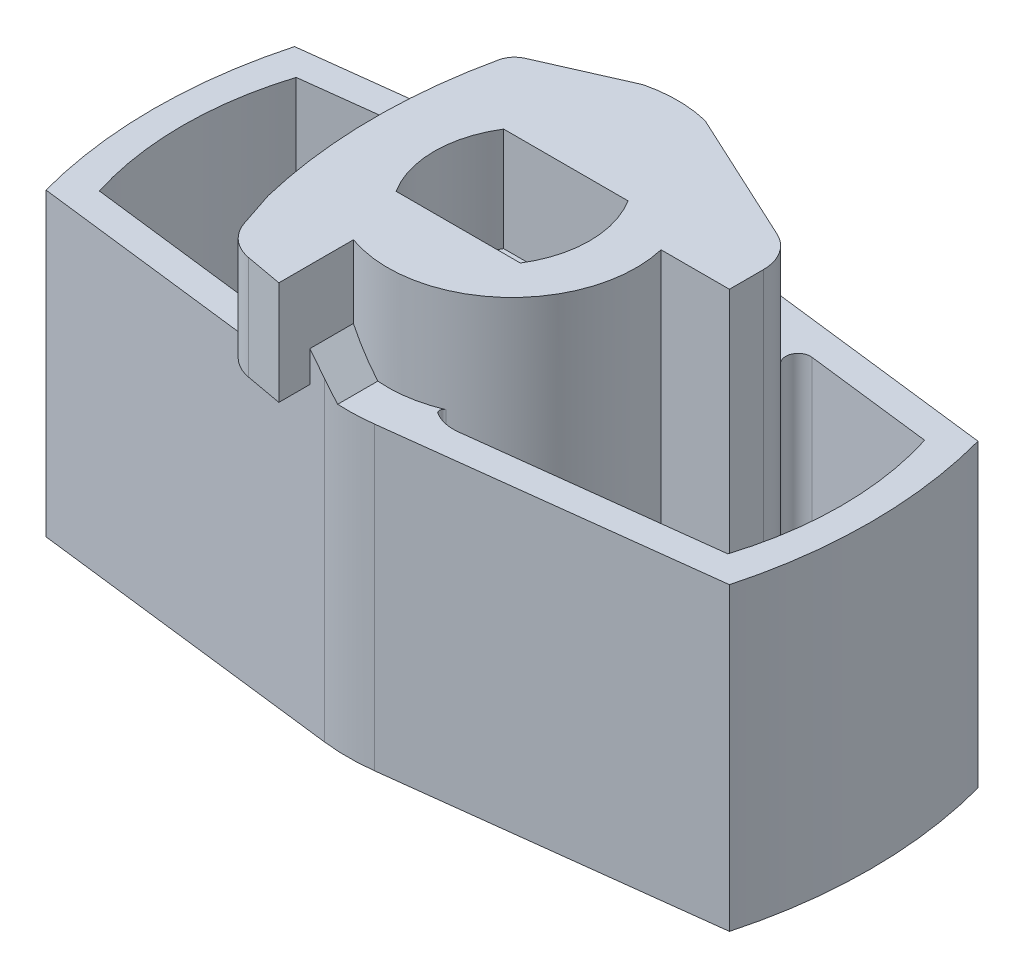
from build123d import *

# Parameters (mm, degrees)
BOSS_EXTRUDE1_DEPTH = 14.5
SKETCH1_3_R         = 1.9999999999999996
BOSS_EXTRUDE2_DEPTH = 2
SKETCH2_R           = 1.9999999999999996
BOSS_EXTRUDE3_DEPTH = 12.5
BOSS_EXTRUDE4_START = -2
SKETCH2_2_R         = 1.9999999999999996
BOSS_EXTRUDE4_DEPTH = 2
BOSS_EXTRUDE5_DEPTH = 5
CHAMFER1_SIZE       = 1.5
FILLET3_R           = 2
FILLET1_R           = 0.6
FILLET4_R           = 2
FILLET5_R           = 0.2
FILLET6_R           = 1
FILLET7_R           = 10


with BuildPart() as part:
    # Sketch1 → Boss-Extrude1 (new body)
    with BuildSketch(Plane(origin=(0, 0, 0), x_dir=(1, 0, 0), z_dir=(0, 1, 0))):
        with BuildLine():
            ThreePointArc((33, 12), (33.8, 6), (33, 0))
            Line((33, 0), (16.499999999999837, -2.00000000000002))
            Line((16.499999999999837, -2.00000000000002), (0, 0))
            ThreePointArc((0, 0), (-0.7999999999999936, 5.999999999999997), (0, 12))
            Line((0, 12), (16.499999999999837, 13.99999999999998))
            Line((16.499999999999837, 13.99999999999998), (33, 12))
        make_face()
        with BuildLine():
            Line((16.49999999999997, 12.589752836725182), (31.673748690170243, 10.750510571250008))
            ThreePointArc((31.673748690170243, 10.750510571250008), (32.39999999999999, 5.999999999999953), (31.673748690170243, 1.2494894287498812))
            Line((31.673748690170243, 1.2494894287498812), (16.49999999999984, -0.5897528367253209))
            Line((16.49999999999984, -0.5897528367253209), (1.3262513098297308, 1.2494894287498826))
            ThreePointArc((1.3262513098297308, 1.2494894287498826), (0.5999999999999286, 5.999999999999944), (1.3262513098297308, 10.750510571250004))
            Line((1.3262513098297308, 10.750510571250004), (16.49999999999997, 12.589752836725182))
        make_face(mode=Mode.SUBTRACT)
    extrude(amount=BOSS_EXTRUDE1_DEPTH)

    # Sketch1<3> → Boss-Extrude2 (add)
    with BuildSketch(Plane(origin=(0, 0, 0), x_dir=(1, 0, 0), z_dir=(0, 1, 0))):
        with BuildLine():
            ThreePointArc((31.673748690170243, 10.750510571250008), (32.39999999999999, 5.999999999999953), (31.673748690170243, 1.2494894287498812))
            Line((31.673748690170243, 1.2494894287498812), (16.49999999999984, -0.5897528367253209))
            Line((16.49999999999984, -0.5897528367253209), (1.3262513098297308, 1.2494894287498826))
            ThreePointArc((1.3262513098297308, 1.2494894287498826), (0.5999999999999286, 5.999999999999944), (1.3262513098297308, 10.750510571250004))
            Line((1.3262513098297308, 10.750510571250004), (16.49999999999997, 12.589752836725182))
            Line((16.49999999999997, 12.589752836725182), (31.673748690170243, 10.750510571250008))
        make_face()
        with Locations(Location((16.499999999999837, 5.999999999999998, 0), (0, 0, 270))):
            Circle(SKETCH1_3_R, mode=Mode.SUBTRACT)
    extrude(amount=BOSS_EXTRUDE2_DEPTH)

    # Sketch2 → Boss-Extrude3 (add)
    with BuildSketch(Plane(origin=(0, 2, 0), x_dir=(1, 0, 0), z_dir=(0, 1, 0))):
        with BuildLine():
            Line((22.34588668015035, 7.351150962268389), (25.64588668015035, 7.351150962268389))
            Line((25.64588668015035, 7.351150962268389), (25.64588668015035, 10.27237722905159))
            Line((25.64588668015035, 10.27237722905159), (17.999999999999844, 13.818181818181802))
            ThreePointArc((17.999999999999844, 13.818181818181802), (16.499999999999844, 13.999999999999986), (14.999999999999844, 13.8181818181818))
            Line((14.999999999999844, 13.8181818181818), (10.599999999999836, 11.874601321573653))
            ThreePointArc((10.599999999999836, 11.874601321573653), (9.899999999999839, 5.999999999999933), (10.599999999999838, 0.12539867842620983))
            Line((10.599999999999838, 0.12539867842620983), (14.499999999999885, -1.7575757575757784))
            Line((14.499999999999885, -1.7575757575757784), (18.499999999999837, -1.7575757575757784))
            Line((18.499999999999837, -1.7575757575757784), (18.499999999999837, 0.34314575050761753))
            ThreePointArc((18.499999999999837, 0.34314575050761753), (21.75999227294638, 3.1133962363111447), (22.34588668015035, 7.351150962268389))
        make_face()
        with Locations(Location((16.499999999999837, 5.999999999999998, 0), (0, 0, 270))):
            Circle(SKETCH2_R, mode=Mode.SUBTRACT)
    extrude(amount=BOSS_EXTRUDE3_DEPTH)

    # Sketch2<2> → Boss-Extrude4 (add)
    with BuildSketch(Plane(origin=(0, 2, 0), x_dir=(1, 0, 0), z_dir=(0, 1, 0)).offset(BOSS_EXTRUDE4_START)):
        with BuildLine():
            Line((22.34588668015035, 7.351150962268389), (25.64588668015035, 7.351150962268389))
            Line((25.64588668015035, 7.351150962268389), (25.64588668015035, 10.27237722905159))
            Line((25.64588668015035, 10.27237722905159), (17.999999999999844, 13.818181818181802))
            ThreePointArc((17.999999999999844, 13.818181818181802), (16.499999999999844, 13.999999999999986), (14.999999999999844, 13.8181818181818))
            Line((14.999999999999844, 13.8181818181818), (10.599999999999836, 11.874601321573653))
            ThreePointArc((10.599999999999836, 11.874601321573653), (9.899999999999839, 5.999999999999933), (10.599999999999838, 0.12539867842620983))
            Line((10.599999999999838, 0.12539867842620983), (14.499999999999885, -1.7575757575757784))
            Line((14.499999999999885, -1.7575757575757784), (18.499999999999837, -1.7575757575757784))
            Line((18.499999999999837, -1.7575757575757784), (18.499999999999837, 0.34314575050761753))
            ThreePointArc((18.499999999999837, 0.34314575050761753), (21.75999227294638, 3.1133962363111447), (22.34588668015035, 7.351150962268389))
        make_face()
        with Locations(Location((16.499999999999837, 5.999999999999998, 0), (0, 0, 270))):
            Circle(SKETCH2_2_R, mode=Mode.SUBTRACT)
    extrude(amount=BOSS_EXTRUDE4_DEPTH)

    # Sketch3 → Boss-Extrude5 (add)
    with BuildSketch(Plane(origin=(0, 14.5, 0), x_dir=(1, 0, 0), z_dir=(0, 1, 0))):
        with BuildLine():
            Line((22.34588668015035, 7.351150962268389), (25.64588668015035, 7.351150962268389))
            Line((25.64588668015035, 7.351150962268389), (25.64588668015035, 10.27237722905159))
            Line((25.64588668015035, 10.27237722905159), (17.999999999999826, 13.81818181818181))
            ThreePointArc((17.999999999999826, 13.81818181818181), (16.499999999999833, 13.99999999999999), (14.999999999999844, 13.818181818181802))
            Line((14.999999999999844, 13.818181818181802), (10.599999999999836, 11.874601321573653))
            ThreePointArc((10.599999999999836, 11.874601321573653), (9.899999999999842, 5.999999999999933), (10.599999999999842, 0.12539867842621155))
            Line((10.599999999999842, 0.12539867842621155), (11.173814866283609, -1.5968518966374832))
            ThreePointArc((11.173814866283609, -1.5968518966374832), (11.760910789091948, -2.4756088583346414), (12.713890329463082, -2.932473626010398))
            Line((12.713890329463082, -2.932473626010398), (14.49999999999984, -3.2568542494923824))
            Line((14.49999999999984, -3.2568542494923824), (14.49999999999984, 0.3431457505076174))
            ThreePointArc((14.49999999999984, 0.3431457505076174), (20.496967019022676, 1.5251531144804868), (22.34588668015035, 7.351150962268389))
        make_face()
        with BuildLine():
            Line((13.499999999999838, 8.599999999999934), (19.499999999999837, 8.599999999999934))
            ThreePointArc((19.499999999999837, 8.599999999999934), (20.249999999999837, 5.999999999999933), (19.499999999999837, 3.3999999999999324))
            Line((19.499999999999837, 3.3999999999999324), (13.499999999999838, 3.3999999999999324))
            ThreePointArc((13.499999999999838, 3.3999999999999324), (12.749999999999837, 5.999999999999932), (13.499999999999838, 8.599999999999934))
        make_face(mode=Mode.SUBTRACT)
    extrude(amount=BOSS_EXTRUDE5_DEPTH)

    # Chamfer1
    chamfer1_edges = [part.edges().sort_by_distance(p)[0] for p in [
        (14.49999999999984, 14.5, 0.7072150035340781),
    ]]
    chamfer(chamfer1_edges, length=CHAMFER1_SIZE)

    # Fillet3
    fillet3_edges = [part.edges().sort_by_distance(p)[0] for p in [
        (25.64588668015035, 10.75, -10.27237722905159),
    ]]
    fillet(fillet3_edges, radius=FILLET3_R)

    # Fillet1
    # the kernel refuses this fillet: 0.6 mm, written as the material it adds along each edge
    with BuildSketch(Plane(origin=(22.11701590469639, 2, -11.90890242403471), x_dir=(0.8942491782496095, 0, 0.44756944399712767), z_dir=(0, 1, 0))) as fillet1_piece_1:
        with BuildLine():
            CenterArc((3.393748585617257, 0.5763680275818249), FILLET1_R, 109.67662149320171, 144.1891632768265)
            Line((3.1917219374131016, 1.1413328348179872), (3.16141794018248, 1.2260775559034116))
            Line((3.16141794018248, 1.2260775559034116), (-0.03030399723062558, 0.08474472108542427))
            Line((-0.03030399723062558, 0.08474472108542427), (0.00268281172049191, -0.08996000512045559))
            ThreePointArc((0.00268281172049191, -0.08996000512045559), (2.614303647054314, -0.01207553882752912), (3.2020056235731444, -0.08645520413727262))
            Line((3.2020056235731444, -0.08645520413727262), (3.227015575144115, 1e-16))
        make_face()
    extrude(amount=12.5)

    # Fillet4
    # the kernel refuses this fillet: 2 mm, written as the material it adds along each edge
    with BuildSketch(Plane(origin=(18.499999999999837, 14.5, 0.34732859430107876), x_dir=(0.9927337820337083, 0, -0.12033136751923736), z_dir=(0, -1, 0))) as fillet4_piece_1:
        with BuildLine():
            CenterArc((1.5903936692052363, -2.0000000000000004), FILLET4_R, 89.99999999999994, 48.90789553913825)
            Line((0.08308572214778008, -0.6854572077191857), (0, 0))
            Line((0, 0), (1.5903936692052383, -1e-17))
        make_face()
    extrude(amount=12.5)

    # Fillet5
    fillet5_edges = [part.edges().sort_by_distance(p)[0] for p in [
        (18.499999999999837, 8.25, -0.34314575050761803),
    ]]
    fillet(fillet5_edges, radius=FILLET5_R)

    # Fillet6
    fillet6_edges = [part.edges().sort_by_distance(p)[0] for p in [
        (10.599999999999834, 17, -11.874601321573653),
    ]]
    fillet(fillet6_edges, radius=FILLET6_R)

    # Fillet7
    fillet7_edges = [part.edges().sort_by_distance(p)[0] for p in [
        (16.499999999999837, 7.25, 2.00000000000002),
    ]]
    fillet(fillet7_edges, radius=FILLET7_R)


solid = part.part
